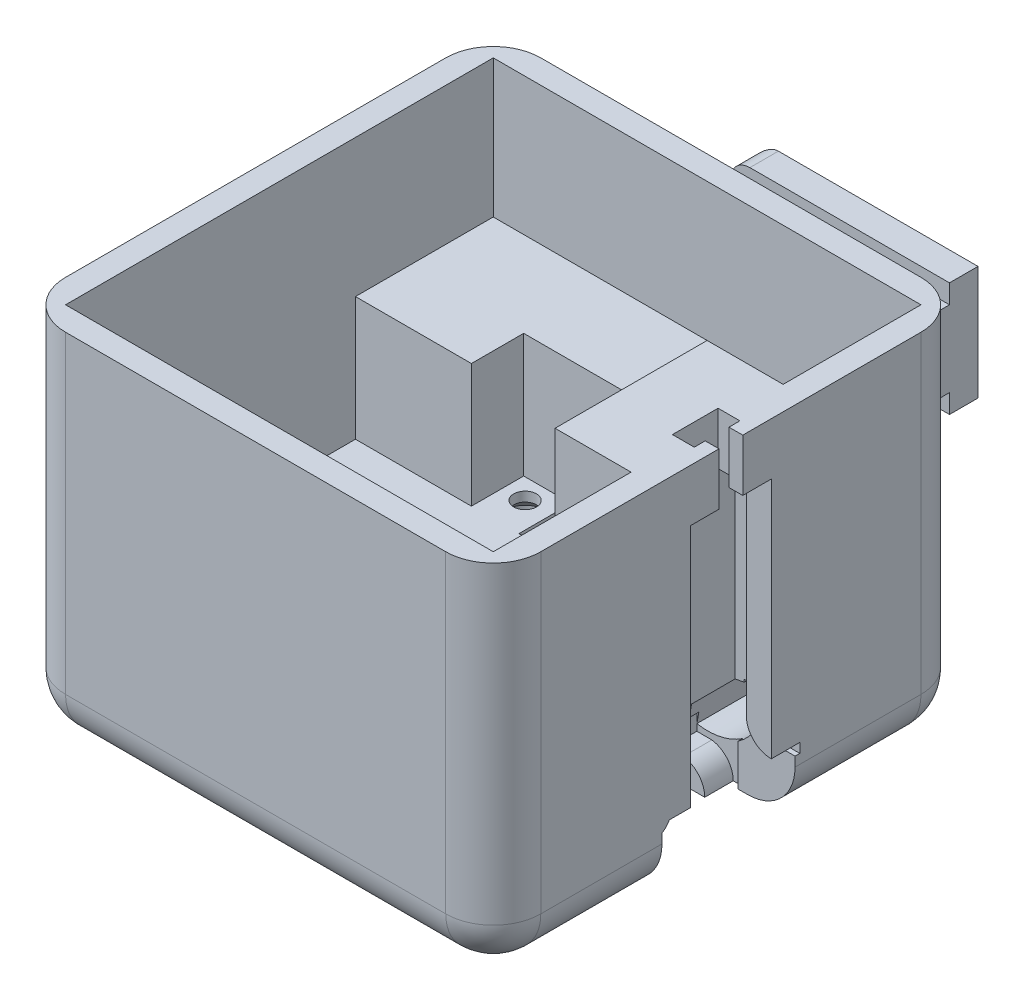
from build123d import *

# Parameters (mm, degrees)
SKETCH1_W                                    = 50
SKETCH1_H                                    = 50
BOSS_EXTRUDE1_DEPTH                          = 38
SHELL1_T                                     = -2.5
BOSS_EXTRUDE2_DEPTH                          = 21
SKETCH3_W                                    = 45
SKETCH3_H                                    = 16
BOSS_EXTRUDE3_DEPTH                          = 8
SKETCH4_W                                    = 32.5
SKETCH4_H                                    = 8.5
CUT_EXTRUDE1_DEPTH                           = 2.6
SKETCH7_W                                    = 32.5
SKETCH7_H                                    = 12.5
CUT_EXTRUDE2_DEPTH                           = 3.2
SKETCH8_W                                    = 16
SKETCH8_H                                    = 27.5
BOSS_EXTRUDE4_DEPTH                          = 8
SKETCH9_W                                    = 8.5
SKETCH9_H                                    = 32.5
CUT_EXTRUDE3_DEPTH                           = 2.6
CUT_EXTRUDE5_DEPTH                           = 3.2
CUT_EXTRUDE7_DEPTH                           = 10
CUT_EXTRUDE7_DEPTH_BACK                      = 2
SKETCH13_W                                   = 2.6
SKETCH13_H                                   = 3.011524732
FILLET1_R                                    = 5
SKETCH16_R                                   = 1.9
CUT_EXTRUDE8_DEPTH                           = 53.768953941
SKETCH17_W                                   = 23
SKETCH17_H                                   = 12
BOSS_EXTRUDE5_DEPTH                          = 6
SKETCH18_W                                   = 3
SKETCH18_H                                   = 2
CUT_EXTRUDE9_DEPTH                           = 57.471231614
CUT_EXTRUDE12_DEPTH                          = 2
CUT_EXTRUDE13_DEPTH                          = 2
CUT_EXTRUDE14_DEPTH                          = 19
CUT_EXTRUDE10_START                          = -19.5
CUT_EXTRUDE10_DEPTH                          = 19.5
FILLET4_R                                    = 2
CUT_EXTRUDE18_DEPTH                          = 13
CUT_EXTRUDE18_DEPTH_BACK                     = 1
SKETCH26_W                                   = 6
SKETCH26_H                                   = 6
BOSS_EXTRUDE6_DEPTH                          = 4.5
SKETCH30_W                                   = 4.8
SKETCH30_H                                   = 2.3
CUT_EXTRUDE19_DEPTH                          = 59.832389039
SKETCH31_W                                   = 2.3
SKETCH31_H                                   = 4.8
CUT_EXTRUDE20_DEPTH                          = 52.402820934
SKETCH34_W                                   = 2
SKETCH34_H                                   = 3.1
CUT_EXTRUDE23_DEPTH                          = 7.3
SKETCH35_W                                   = 5
SKETCH35_H                                   = 5.5
BOSS_EXTRUDE7_DEPTH                          = 8
SKETCH36_W                                   = 5
SKETCH36_H                                   = 6
BOSS_EXTRUDE8_DEPTH                          = 8
CSK_SLOT_FOR_M2_COUNTERSUNK_FLAT_HEA_2_COUNT = 2
CSK_SLOT_FOR_M2_COUNTERSUNK_FLAT_HEA_2_PITCH = 29.99
CSK_SLOT_FOR_M2_COUNTERSUNK_FLAT_HEA_3_COUNT = 2
CSK_SLOT_FOR_M2_COUNTERSUNK_FLAT_HEA_3_PITCH = 16
CSK_SLOT_FOR_M2_COUNTERSUNK_FLAT_HEA_4_COUNT = 2
CSK_SLOT_FOR_M2_COUNTERSUNK_FLAT_HEA_4_PITCH = 33.991176796
CUT_EXTRUDE26_DEPTH                          = 2
SKETCH45_R                                   = 3.75
CUT_EXTRUDE27_DEPTH                          = 20
SKETCH46_W                                   = 2.250257739
SKETCH46_H                                   = 4.828713155
SKETCH46_W_2                                 = 4.828713155
SKETCH46_H_2                                 = 1.850257739
CUT_EXTRUDE28_DEPTH                          = 1
CUT_EXTRUDE25_DEPTH                          = 3
CUT_EXTRUDE24_DEPTH                          = 3
FILLET8_R                                    = 2
CUT_EXTRUDE36_REACH                          = 72.036
SKETCH56_W                                   = 2.5
SKETCH56_H                                   = 5.5
CUT_EXTRUDE37_REACH                          = 57.045
SKETCH57_W                                   = 17.5
SKETCH57_H                                   = 2.5
CUT_EXTRUDE38_START                          = -1.45
SKETCH58_W                                   = 11.391229183
SKETCH58_H                                   = 4.8
CUT_EXTRUDE38_DEPTH                          = 1.45


with BuildPart() as part:
    # Sketch1 → Boss-Extrude1 (new body)
    with BuildSketch(Plane(origin=(0, 0, 0), x_dir=(1, 0, 0), z_dir=(0, 1, 0))):
        Rectangle(SKETCH1_W, SKETCH1_H)
    extrude(amount=BOSS_EXTRUDE1_DEPTH)

    # Shell1
    shell1_openings = [part.faces().sort_by_distance(p)[0] for p in [
        (0, 38, 0),
    ]]
    offset(amount=SHELL1_T, openings=shell1_openings, kind=Kind.INTERSECTION)

    # Sketch2 → Boss-Extrude2 (add)
    with BuildSketch(Plane(origin=(0, 2.5, 0), x_dir=(1, 0, 0), z_dir=(0, 1, 0))):
        Polygon((-10.3, -13.6), (-22.5, -13.6), (-22.5, -22.5), (0.190053949, -22.5), (22.5, -22.5), (22.5, -13.6), (10.3, -13.6), (10.3, -20.79), (0.190053949, -20.79), (-10.3, -20.79), align=None)
        Polygon((-22.5, 8), (-10.3, 8), (-10.3, 13.5), (0, 13.5), (10.3, 13.5), (10.3, 8), (22.5, 8), (22.5, 22.5), (0, 22.5), (-22.5, 22.5), align=None)
    extrude(amount=BOSS_EXTRUDE2_DEPTH)

    # Sketch3 → Boss-Extrude3 (add)
    with BuildSketch(Plane(origin=(0, 2.5, 0), x_dir=(1, 0, 0), z_dir=(0, 1, 0))):
        Rectangle(SKETCH3_W, SKETCH3_H)
    extrude(amount=BOSS_EXTRUDE3_DEPTH)

    # Sketch4 → Cut-Extrude1 (cut)
    with BuildSketch(Plane.XZ):
        with Locations((8.75, 0)):
            Rectangle(SKETCH4_W, SKETCH4_H)
    extrude(amount=-CUT_EXTRUDE1_DEPTH, mode=Mode.SUBTRACT)

    # Sketch7 → Cut-Extrude2 (cut)
    with BuildSketch(Plane(origin=(0, 2.6, 0), x_dir=(-1, 0, 0), z_dir=(0, -1, 0))):
        with Locations((-8.75, 0)):
            Rectangle(SKETCH7_W, SKETCH7_H)
    extrude(amount=-CUT_EXTRUDE2_DEPTH, mode=Mode.SUBTRACT)

    # Sketch8 → Boss-Extrude4 (add)
    with BuildSketch(Plane.ZY.offset(-22.5)):
        with Locations((0, 24.25)):
            Rectangle(SKETCH8_W, SKETCH8_H)
    extrude(amount=BOSS_EXTRUDE4_DEPTH)

    # Sketch9 → Cut-Extrude3 (cut)
    with BuildSketch(Plane(origin=(25, 0, 0), x_dir=(0, 0, -1), z_dir=(1, 0, 0))):
        with Locations((0, 16.25)):
            Rectangle(SKETCH9_W, SKETCH9_H)
    extrude(amount=-CUT_EXTRUDE3_DEPTH, mode=Mode.SUBTRACT)

    # Sketch10 → Cut-Extrude5 (cut)
    with BuildSketch(Plane(origin=(22.4, 0, 0), x_dir=(0, 0, -1), z_dir=(1, 0, 0))):
        Polygon((-6.25, 32.5), (-6.25, 0), (6.25, 0), (6.25, 2.6), (6.25, 32.5), align=None)
    extrude(amount=-CUT_EXTRUDE5_DEPTH, mode=Mode.SUBTRACT)

    # Sketch13 → Cut-Extrude7 (cut, two sides: drawn at the far end of the back side and taken through both)
    with BuildSketch(Plane(origin=(0, 0, 4.25), x_dir=(-1, 0, 0), z_dir=(0, 0, -1)).offset(-CUT_EXTRUDE7_DEPTH_BACK)):
        with Locations((-23.7, 1.505762366)):
            Rectangle(SKETCH13_W, SKETCH13_H)
    extrude(amount=CUT_EXTRUDE7_DEPTH + CUT_EXTRUDE7_DEPTH_BACK, mode=Mode.SUBTRACT)

    # Fillet1
    # the kernel refuses this fillet: 5 mm, written as the material it takes off along each edge
    with BuildSketch(Plane(origin=(-20, 5, 20), x_dir=(0, 0, 1), z_dir=(-1, 0, 0))) as fillet1_piece_1_section:
        Polygon((0, 0), (FILLET1_R, 0), (FILLET1_R, -FILLET1_R), (0, -FILLET1_R), align=None)
    fillet1_piece_1 = extrude(amount=FILLET1_R, mode=Mode.PRIVATE)
    fillet1_piece_1 = fillet1_piece_1 - Plane(origin=(-20, 5, 20), x_dir=(0, 0.7071067811865475, -0.7071067811865475), z_dir=(-1, 0, 0)) * Sphere(FILLET1_R, mode=Mode.PRIVATE)
    add(fillet1_piece_1, mode=Mode.SUBTRACT)
    with BuildSketch(Plane(origin=(20, 5, 20), x_dir=(0, -1, 0), z_dir=(0, 0, 1))) as fillet1_piece_2_section:
        Polygon((0, 0), (FILLET1_R, 0), (FILLET1_R, FILLET1_R), (0, FILLET1_R), align=None)
    fillet1_piece_2 = extrude(amount=FILLET1_R, mode=Mode.PRIVATE)
    fillet1_piece_2 = fillet1_piece_2 - Plane(origin=(20, 5, 20), x_dir=(-0.7071067811865475, 0.7071067811865475, 0), z_dir=(0, 0, 1)) * Sphere(FILLET1_R, mode=Mode.PRIVATE)
    add(fillet1_piece_2, mode=Mode.SUBTRACT)
    with BuildSketch(Plane(origin=(20, 5, -20), x_dir=(1, 0, 0), z_dir=(0, 0, -1))) as fillet1_piece_3_section:
        Polygon((0, 0), (FILLET1_R, 0), (FILLET1_R, FILLET1_R), (0, FILLET1_R), align=None)
    fillet1_piece_3 = extrude(amount=FILLET1_R, mode=Mode.PRIVATE)
    fillet1_piece_3 = fillet1_piece_3 - Plane(origin=(20, 5, -20), x_dir=(-0.7071067811865475, 0.7071067811865475, 0), z_dir=(0, 0, -1)) * Sphere(FILLET1_R, mode=Mode.PRIVATE)
    add(fillet1_piece_3, mode=Mode.SUBTRACT)
    with BuildSketch(Plane(origin=(-20, 5, -20), x_dir=(-1, 0, 0), z_dir=(0, 0, -1))) as fillet1_piece_4_section:
        Polygon((0, 0), (FILLET1_R, 0), (FILLET1_R, -FILLET1_R), (0, -FILLET1_R), align=None)
    fillet1_piece_4 = extrude(amount=FILLET1_R, mode=Mode.PRIVATE)
    fillet1_piece_4 = fillet1_piece_4 - Plane(origin=(-20, 5, -20), x_dir=(0.7071067811865475, 0.7071067811865475, 0), z_dir=(0, 0, -1)) * Sphere(FILLET1_R, mode=Mode.PRIVATE)
    add(fillet1_piece_4, mode=Mode.SUBTRACT)
    with BuildSketch(Plane(origin=(-25, 5, 25), x_dir=(1, 0, 0), z_dir=(0, 1, 0)), Plane(origin=(25, 5, -25), x_dir=(-1, 0, 0), z_dir=(0, 1, 0))) as fillet1_piece_5:
        with BuildLine():
            CenterArc((FILLET1_R, FILLET1_R), FILLET1_R, 180, 90)
            Line((0, FILLET1_R), (0, 0))
            Line((0, 0), (FILLET1_R, 0))
        make_face()
    extrude(amount=45.5, mode=Mode.SUBTRACT)
    with BuildSketch(Plane(origin=(25, 5, 25), x_dir=(-1, 0, 0), z_dir=(0, 1, 0)), Plane(origin=(-25, 5, -25), x_dir=(1, 0, 0), z_dir=(0, 1, 0))) as fillet1_piece_6:
        with BuildLine():
            CenterArc((FILLET1_R, -FILLET1_R), FILLET1_R, 90, 90)
            Line((0, -FILLET1_R), (0, 0))
            Line((0, 0), (FILLET1_R, 0))
        make_face()
    extrude(amount=45.5, mode=Mode.SUBTRACT)
    with BuildSketch(Plane(origin=(-25, 0, -20), x_dir=(1, 0, 0), z_dir=(0, 0, 1))) as fillet1_piece_7:
        with BuildLine():
            CenterArc((FILLET1_R, FILLET1_R), FILLET1_R, 180, 90)
            Line((0, FILLET1_R), (0, 0))
            Line((0, 0), (FILLET1_R, 0))
        make_face()
    extrude(amount=40, mode=Mode.SUBTRACT)
    with BuildSketch(Plane(origin=(-20, 0, 25), x_dir=(0, 1, 0), z_dir=(1, 0, 0)), Plane(origin=(20, 0, -25), x_dir=(0, 1, 0), z_dir=(-1, 0, 0))) as fillet1_piece_8:
        with BuildLine():
            CenterArc((FILLET1_R, -FILLET1_R), FILLET1_R, 90, 90)
            Line((0, -FILLET1_R), (0, 0))
            Line((0, 0), (FILLET1_R, 0))
        make_face()
    extrude(amount=40, mode=Mode.SUBTRACT)
    with BuildSketch(Plane(origin=(25, 0, 20), x_dir=(-1, 0, 0), z_dir=(0, 0, -1))) as fillet1_piece_9:
        with BuildLine():
            CenterArc((FILLET1_R, FILLET1_R), FILLET1_R, 180, 90)
            Line((0, FILLET1_R), (0, 0))
            Line((0, 0), (FILLET1_R, 0))
        make_face()
    extrude(amount=26.25, mode=Mode.SUBTRACT)
    with BuildSketch(Plane(origin=(25, 0, 6.75), x_dir=(-1, 0, 0), z_dir=(0, 0, -1))) as fillet1_piece_10:
        with BuildLine():
            CenterArc((FILLET1_R, FILLET1_R), FILLET1_R, 180, 90)
            Line((0, FILLET1_R), (0, 0))
            Line((0, 0), (FILLET1_R, 0))
        make_face()
    extrude(amount=26.75, mode=Mode.SUBTRACT)

    # Sketch16 → Cut-Extrude8 (cut, through all)
    with BuildSketch(Plane(origin=(0, 0, 1.75), x_dir=(-1, 0, 0), z_dir=(0, 0, -1))):
        with Locations(Location((-15.3, 9.7, 0), (0, 0, 65.09893763))):
            Circle(SKETCH16_R)
    extrude(amount=CUT_EXTRUDE8_DEPTH, mode=Mode.SUBTRACT)

    # Sketch17 → Boss-Extrude5 (add)
    with BuildSketch(Plane(origin=(0, 0, -25), x_dir=(-1, 0, 0), z_dir=(0, 0, -1))):
        with Locations((-8.5, 30)):
            Rectangle(SKETCH17_W, SKETCH17_H)
    extrude(amount=BOSS_EXTRUDE5_DEPTH)

    # Sketch18 → Cut-Extrude9 (cut, through all)
    with BuildSketch(Plane.ZY.offset(3)):
        with Locations((-26.5, 25)):
            Rectangle(SKETCH18_W, SKETCH18_H)
        with Locations((-26.5, 35)):
            Rectangle(SKETCH18_W, SKETCH18_H)
    extrude(amount=-CUT_EXTRUDE9_DEPTH, mode=Mode.SUBTRACT)

    # Sketch20 → Cut-Extrude12 (cut)
    with BuildSketch(Plane(origin=(0, 0, 4.25), x_dir=(-1, 0, 0), z_dir=(0, 0, -1))):
        with BuildLine():
            Line((-22.4, 7), (-22.4, 9.053333333))
            ThreePointArc((-22.4, 9.053333333), (-23.279715786, 7.441723343), (-25, 6.8))
            Line((-25, 6.8), (-25, 5.8))
            Line((-25, 5.8), (-24, 5.8))
            Line((-24, 5.8), (-22.4, 5.8))
            Line((-22.4, 5.8), (-22.4, 7))
        make_face()
    extrude(amount=-CUT_EXTRUDE12_DEPTH, mode=Mode.SUBTRACT)

    # Sketch21 → Cut-Extrude13 (cut)
    with BuildSketch(Plane(origin=(0, 0, 4.25), x_dir=(-1, 0, 0), z_dir=(0, 0, -1))):
        with BuildLine():
            Line((-15.946666667, 2.6), (-19.2, 2.6))
            Line((-19.2, 2.6), (-19.2, 0))
            Line((-19.2, 0), (-18.2, 0))
            ThreePointArc((-18.2, 0), (-17.558276657, 1.720284214), (-15.946666667, 2.6))
        make_face()
    extrude(amount=-CUT_EXTRUDE13_DEPTH, mode=Mode.SUBTRACT)

    # Sketch22 → Cut-Extrude14 (cut)
    with BuildSketch(Plane(origin=(0, 0, 4.25), x_dir=(-1, 0, 0), z_dir=(0, 0, -1))):
        with BuildLine():
            Line((-15.3, 9.7), (-14.171286845, 3.298749605))
            ThreePointArc((-14.171286845, 3.298749605), (-19.896194078, 5.103805922), (-21.701250395, 10.828713155))
            Line((-21.701250395, 10.828713155), (-15.3, 9.7))
        make_face()
    extrude(amount=CUT_EXTRUDE14_DEPTH, mode=Mode.SUBTRACT)

    # Sketch19 → Cut-Extrude10 (cut)
    with BuildSketch(Plane(origin=(0, 0, -25), x_dir=(-1, 0, 0), z_dir=(0, 0, -1)).offset(CUT_EXTRUDE10_START)):
        with BuildLine():
            ThreePointArc((-16.15049081, 8.000981053), (-16.643502884, 8.356497116), (-16.999018947, 8.84950919))
            Line((-16.999018947, 8.84950919), (-17.600059711, 8.248468426))
            Line((-17.600059711, 8.248468426), (-16.751531574, 7.399940289))
            Line((-16.751531574, 7.399940289), (-16.15049081, 8.000981053))
        make_face()
        with BuildLine():
            ThreePointArc((-14.44950919, 11.399018947), (-13.956497116, 11.043502884), (-13.600981053, 10.55049081))
            Line((-13.600981053, 10.55049081), (-12.999940289, 11.151531574))
            Line((-12.999940289, 11.151531574), (-13.848468426, 12.000059711))
            Line((-13.848468426, 12.000059711), (-14.44950919, 11.399018947))
        make_face()
    extrude(amount=CUT_EXTRUDE10_DEPTH, mode=Mode.SUBTRACT)

    # Fillet4
    fillet4_edges = [part.edges().sort_by_distance(p)[0] for p in [
        (-3, 36, -29.5),
        (-3, 24, -29.5),
        (-3, 30, -31),
    ]]
    fillet(fillet4_edges, radius=FILLET4_R)

    # Sketch26 → Cut-Extrude18 (cut, two sides: drawn at the far end of the back side and taken through both)
    with BuildSketch(Plane(origin=(0, 0, 6.25), x_dir=(-1, 0, 0), z_dir=(0, 0, -1)).offset(-CUT_EXTRUDE18_DEPTH_BACK)):
        with Locations((-22, 3)):
            Rectangle(SKETCH26_W, SKETCH26_H)
    extrude(amount=CUT_EXTRUDE18_DEPTH + CUT_EXTRUDE18_DEPTH_BACK, mode=Mode.SUBTRACT)

    # Sketch29 → Boss-Extrude6 (add)
    with BuildSketch(Plane(origin=(0, 0, 6.25), x_dir=(-1, 0, 0), z_dir=(0, 0, -1))):
        with BuildLine():
            Line((-16.732571013, 9.952600921), (-15.813381383, 9.141951865))
            Line((-15.813381383, 9.141951865), (-15.034718446, 8.195513544))
            ThreePointArc((-15.034718446, 8.195513544), (-14.932032445, 9.993588828), (-16.732571013, 9.952600921))
        make_face()
    extrude(amount=BOSS_EXTRUDE6_DEPTH)

    # Sketch30 → Cut-Extrude19 (cut, through all)
    with BuildSketch(Plane(origin=(-7.5, 0, 0), x_dir=(0, 0, -1), z_dir=(1, 0, 0))):
        with Locations((0, 2.6)):
            Rectangle(SKETCH30_W, SKETCH30_H)
    extrude(amount=-CUT_EXTRUDE19_DEPTH, mode=Mode.SUBTRACT)

    # Sketch31 → Cut-Extrude20 (cut, through all)
    with BuildSketch(Plane.XZ.offset(-32.5)):
        with Locations((22.4, 0)):
            Rectangle(SKETCH31_W, SKETCH31_H)
    extrude(amount=-CUT_EXTRUDE20_DEPTH, mode=Mode.SUBTRACT)

    # Sketch34 → Cut-Extrude23 (cut)
    with BuildSketch(Plane(origin=(0, 10.5, 0), x_dir=(1, 0, 0), z_dir=(0, 1, 0))):
        with Locations((-14.45, 0)):
            Rectangle(SKETCH34_W, SKETCH34_H)
    extrude(amount=-CUT_EXTRUDE23_DEPTH, mode=Mode.SUBTRACT)

    # Sketch35 → Boss-Extrude7 (add)
    with BuildSketch(Plane(origin=(0, 2.5, 0), x_dir=(1, 0, 0), z_dir=(0, 1, 0))):
        with Locations((-7.8, 10.75)):
            Rectangle(SKETCH35_W, SKETCH35_H)
        with Locations((7.8, 10.75)):
            Rectangle(SKETCH35_W, SKETCH35_H)
    extrude(amount=BOSS_EXTRUDE7_DEPTH)

    # Sketch36 → Boss-Extrude8 (add)
    with BuildSketch(Plane(origin=(0, 2.5, 0), x_dir=(1, 0, 0), z_dir=(0, 1, 0))):
        with Locations((-7.8, -17.79)):
            Rectangle(SKETCH36_W, SKETCH36_H)
        with Locations((7.8, -17.79)):
            Rectangle(SKETCH36_W, SKETCH36_H)
    extrude(amount=BOSS_EXTRUDE8_DEPTH)

    # Sketch39 → CSK SLOT for M2 Countersunk Flat Head Sc (revolve, cut)
    with BuildSketch(Plane(origin=(8, 0, 18.64), x_dir=(0, 0, -1), z_dir=(1, 0, 0))):
        Polygon((0, 0), (0, 11.221032743), (1.2, 10.5), (1.2, 9.5), (2.2, 8.5), (2.2, 0), align=None)
    csk_slot_for_m2_countersunk_flat_head_sc = revolve(axis=Axis((8, -6.35, 18.64), (0, 1, 0)), mode=Mode.SUBTRACT)

    # CSK SLOT for M2 Countersunk Flat Hea 2: CSK SLOT for M2 Countersunk Flat Head Sc ×2
    with Locations(*[(0, 0, -i * CSK_SLOT_FOR_M2_COUNTERSUNK_FLAT_HEA_2_PITCH) for i in range(1, CSK_SLOT_FOR_M2_COUNTERSUNK_FLAT_HEA_2_COUNT)]):
        add(csk_slot_for_m2_countersunk_flat_head_sc, mode=Mode.SUBTRACT)

    # CSK SLOT for M2 Countersunk Flat Hea 3: CSK SLOT for M2 Countersunk Flat Head Sc ×2
    with Locations(*[(-i * CSK_SLOT_FOR_M2_COUNTERSUNK_FLAT_HEA_3_PITCH, 0, 0) for i in range(1, CSK_SLOT_FOR_M2_COUNTERSUNK_FLAT_HEA_3_COUNT)]):
        add(csk_slot_for_m2_countersunk_flat_head_sc, mode=Mode.SUBTRACT)

    # CSK SLOT for M2 Countersunk Flat Hea 4: CSK SLOT for M2 Countersunk Flat Head Sc ×2
    with Locations(*[Vector(-0.47071038745922766, 0, -0.882287782493889) * (i * CSK_SLOT_FOR_M2_COUNTERSUNK_FLAT_HEA_4_PITCH) for i in range(1, CSK_SLOT_FOR_M2_COUNTERSUNK_FLAT_HEA_4_COUNT)]):
        add(csk_slot_for_m2_countersunk_flat_head_sc, mode=Mode.SUBTRACT)

    # Sketch44 → Cut-Extrude26 (cut)
    with BuildSketch(Plane(origin=(0, 0, 4.25), x_dir=(-1, 0, 0), z_dir=(0, 0, -1))):
        Polygon((-19.2, 10.387675225), (-19.2, 5.8), (-14.612324775, 5.8), (-15.034718446, 8.195513544), (-15.813381383, 9.141951865), (-16.732571013, 9.952600921), align=None)
    extrude(amount=-CUT_EXTRUDE26_DEPTH, mode=Mode.SUBTRACT)

    # Sketch45 → Cut-Extrude27 (cut)
    with BuildSketch(Plane(origin=(0, 0, 1.75), x_dir=(-1, 0, 0), z_dir=(0, 0, -1))):
        with Locations(Location((-15.3, 9.7, 0), (0, 0, 170))):
            Circle(SKETCH45_R)
    extrude(amount=CUT_EXTRUDE27_DEPTH, mode=Mode.SUBTRACT)

    # Sketch46 → Cut-Extrude28 (cut)
    with BuildSketch(Plane.XY.offset(-6.25)):
        with Locations((21.274871131, 8.414356578)):
            Rectangle(SKETCH46_W, SKETCH46_H)
        with Locations((16.585643422, 3.52512887)):
            Rectangle(SKETCH46_W_2, SKETCH46_H_2)
    extrude(amount=-CUT_EXTRUDE28_DEPTH, mode=Mode.SUBTRACT)

    # Sketch43 → Cut-Extrude25 (cut)
    with BuildSketch(Plane.XY.offset(-4.25)):
        with BuildLine():
            Line((18, 0), (19, 0))
            Line((19, 0), (19, 2.6))
            Line((19, 2.6), (15.746666667, 2.6))
            ThreePointArc((15.746666667, 2.6), (17.358276657, 1.720284214), (18, 0))
        make_face()
    extrude(amount=-CUT_EXTRUDE25_DEPTH, mode=Mode.SUBTRACT)

    # Sketch42 → Cut-Extrude24 (cut)
    with BuildSketch(Plane.XY.offset(-4.25)):
        with BuildLine():
            Line((22.4, 9.253333333), (22.4, 6))
            Line((22.4, 6), (25, 6))
            Line((25, 6), (25, 7))
            ThreePointArc((25, 7), (23.279715786, 7.641723343), (22.4, 9.253333333))
        make_face()
    extrude(amount=-CUT_EXTRUDE24_DEPTH, mode=Mode.SUBTRACT)

    # Fillet8
    # the kernel refuses this fillet: 2 mm, written as the material it takes off along each edge
    with BuildSketch(Plane(origin=(19, 6, 6.25), x_dir=(-1, 0, 0), z_dir=(0, -1, 0))) as fillet8_piece_1_section:
        with BuildLine():
            CenterArc((1.732050808, -2), FILLET8_R, 90, 60)
            Line((0, -1), (0, 0))
            Line((0, 0), (1.732050808, 0))
        make_face()
    fillet8_piece_1 = extrude(amount=10.330127019, mode=Mode.PRIVATE)
    fillet8_piece_1 = fillet8_piece_1 - Plane(origin=(15.573333333, 0, 6.25), x_dir=(1, 0, 0), z_dir=(0, 0, -1)) * Cylinder(2.626666667, 28, mode=Mode.PRIVATE)
    add(fillet8_piece_1, mode=Mode.SUBTRACT)
    with BuildSketch(Plane(origin=(19, 6, 6.25), x_dir=(0, 1, 0), z_dir=(1, 0, 0))) as fillet8_piece_2_section:
        with BuildLine():
            CenterArc((1.732050808, 2), FILLET8_R, 210, 60)
            Line((0, 1), (0, 0))
            Line((0, 0), (1.732050808, 0))
        make_face()
    fillet8_piece_2 = extrude(amount=10.330127019, mode=Mode.PRIVATE)
    fillet8_piece_2 = fillet8_piece_2 - Plane(origin=(25, 9.426666667, 6.25), x_dir=(-0.9898477157360407, -0.14213197969543132, 0), z_dir=(0, 0, -1)) * Cylinder(2.626666667, 28, mode=Mode.PRIVATE)
    add(fillet8_piece_2, mode=Mode.SUBTRACT)
    with BuildSketch(Plane(origin=(14.669872981, 6, 6.25), x_dir=(0, 1, 0), z_dir=(1, 0, 0))) as fillet8_piece_3a_section:
        with BuildLine():
            CenterArc((1.732050808, 2), FILLET8_R, 210, 60)
            Line((0, 1), (0, 0))
            Line((0, 0), (1.732050808, 0))
        make_face()
    fillet8_piece_3a = extrude(amount=10.330127019, mode=Mode.PRIVATE)
    fillet8_piece_3a = split(fillet8_piece_3a, bisect_by=Plane(origin=(19, 6, 6.25), z_dir=(-1, 0, 0)), keep=Keep.TOP, mode=Mode.PRIVATE)
    fillet8_piece_3a = split(fillet8_piece_3a, bisect_by=Plane(origin=(14.64826208, 6.003810585, 6.25), z_dir=(0.9848077530122075, -0.17364817766693366, 0)), keep=Keep.TOP, mode=Mode.PRIVATE)
    with BuildSketch(Plane(origin=(19, 10.330127019, 6.25), x_dir=(-1, 0, 0), z_dir=(0, -1, 0))) as fillet8_piece_3b_section:
        with BuildLine():
            CenterArc((1.732050808, -2), FILLET8_R, 90, 60)
            Line((0, -1), (0, 0))
            Line((0, 0), (1.732050808, 0))
        make_face()
    fillet8_piece_3b = extrude(amount=10.330127019, mode=Mode.PRIVATE)
    fillet8_piece_3b = split(fillet8_piece_3b, bisect_by=Plane(origin=(19, 6, 6.25), z_dir=(0, 1, 0)), keep=Keep.TOP, mode=Mode.PRIVATE)
    fillet8_piece_3b = split(fillet8_piece_3b, bisect_by=Plane(origin=(18.996189415, 10.35173792, 6.25), z_dir=(0.17364817766693197, -0.9848077530122078, 0)), keep=Keep.TOP, mode=Mode.PRIVATE)
    fillet8_piece_3 = fillet8_piece_3a & fillet8_piece_3b
    add(fillet8_piece_3, mode=Mode.SUBTRACT)

    # Sketch56 → Cut-Extrude36 (cut, up to next)
    with BuildSketch(Plane(origin=(25, 0, 0), x_dir=(0, 0, -1), z_dir=(1, 0, 0)), mode=Mode.PRIVATE) as cut_extrude36_sk1:
        with Locations((0, 35.25)):
            Rectangle(SKETCH56_W, SKETCH56_H)
    cut_extrude36_tool1 = extrude(cut_extrude36_sk1.sketch, amount=-CUT_EXTRUDE36_REACH, mode=Mode.PRIVATE) & part.part
    add(cut_extrude36_tool1.solids().sort_by_distance((25, 35.25, 0))[0], mode=Mode.SUBTRACT)

    # Sketch57 → Cut-Extrude37 (cut, up to next)
    with BuildSketch(Plane.XZ, mode=Mode.PRIVATE) as cut_extrude37_sk1:
        with Locations((-16.25, 0)):
            Rectangle(SKETCH57_W, SKETCH57_H)
    cut_extrude37_tool1 = extrude(cut_extrude37_sk1.sketch, amount=-CUT_EXTRUDE37_REACH, mode=Mode.PRIVATE) & part.part
    add(cut_extrude37_tool1.solids().sort_by_distance((-16.25, 0, 0))[0], mode=Mode.SUBTRACT)

    # Sketch58 → Cut-Extrude38 (cut)
    with BuildSketch(Plane.XZ.offset(CUT_EXTRUDE38_START)):
        with Locations((-19.145614592, 0)):
            Rectangle(SKETCH58_W, SKETCH58_H)
    extrude(amount=CUT_EXTRUDE38_DEPTH, mode=Mode.SUBTRACT)


solid = part.part
